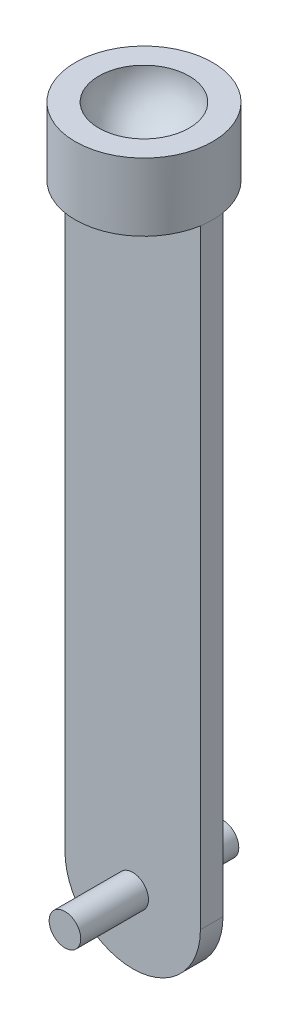
from build123d import *

# Parameters (mm, degrees)
BOSS_EXTRUDE1_DEPTH = 2.5
SKETCH4_R           = 15.206906326
BOSS_EXTRUDE2_DEPTH = 15
SKETCH7_R           = 3.5
BOSS_EXTRUDE3_DEPTH = 15


with BuildPart() as part:
    # Sketch1 → Boss-Extrude1 (new, symmetric)
    with BuildSketch(Plane.XY):
        with BuildLine():
            Line((-15, -75), (-15, 75))
            Line((-15, 75), (15, 75))
            Line((15, 75), (15, -75))
            ThreePointArc((15, -75), (0, -90), (-15, -75))
        make_face()
    extrude(amount=BOSS_EXTRUDE1_DEPTH, both=True)

    # Sketch4 → Boss-Extrude2 (add)
    with BuildSketch(Plane(origin=(0, 75, 0), x_dir=(1, 0, 0), z_dir=(0, 1, 0))):
        Circle(SKETCH4_R)
    extrude(amount=-BOSS_EXTRUDE2_DEPTH)

    # Sketch6 → Cut-Revolve3 (revolve, cut)
    with BuildSketch(Plane.XY):
        with BuildLine():
            Line((0, 75), (10, 75))
            ThreePointArc((10, 75), (7.071067812, 67.928932188), (0, 65))
            Line((0, 65), (0, 75))
        make_face()
    revolve(axis=Axis((0, 75, 0), (0, -1, 0)), mode=Mode.SUBTRACT)

    # Sketch7 → Boss-Extrude3 (add)
    with BuildSketch(Plane.XY.offset(2.5)):
        with Locations((0, -75)):
            Circle(SKETCH7_R)
    boss_extrude3 = extrude(amount=BOSS_EXTRUDE3_DEPTH)

    # Mirror1: Boss-Extrude3 across plane
    add(boss_extrude3.mirror(Plane.XY))


solid = part.part
